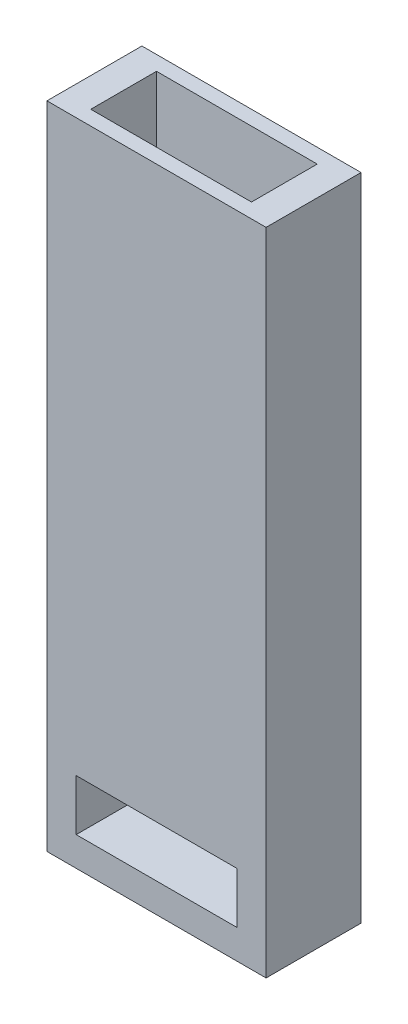
from build123d import *

# Parameters (mm, degrees)
SKETCH1_W           = 30
SKETCH1_H           = 13
BOSS_EXTRUDE1_DEPTH = 85
SKETCH2_W           = 22
SKETCH2_H           = 9
CUT_EXTRUDE2_DEPTH  = 85
SKETCH5_W           = 30
SKETCH5_H           = 13
BOSS_EXTRUDE3_DEPTH = 4
SKETCH12_W          = 22
SKETCH12_H          = 7
CUT_EXTRUDE4_DEPTH  = 13


with BuildPart() as part:
    # Sketch1 → Boss-Extrude1 (new body)
    with BuildSketch(Plane(origin=(0, 0, 0), x_dir=(1, 0, 0), z_dir=(0, 1, 0))):
        with Locations((15, -6.5)):
            Rectangle(SKETCH1_W, SKETCH1_H)
    extrude(amount=BOSS_EXTRUDE1_DEPTH)

    # Sketch2 → Cut-Extrude2 (cut)
    with BuildSketch(Plane(origin=(0, 85, 0), x_dir=(1, 0, 0), z_dir=(0, 1, 0))):
        with Locations((15, -6.5)):
            Rectangle(SKETCH2_W, SKETCH2_H)
    extrude(amount=-CUT_EXTRUDE2_DEPTH, mode=Mode.SUBTRACT)

    # Sketch5 → Boss-Extrude3 (add)
    with BuildSketch(Plane(origin=(0, 0, 0), x_dir=(1, 0, 0), z_dir=(0, 1, 0))):
        with Locations((15, -6.5)):
            Rectangle(SKETCH5_W, SKETCH5_H)
    extrude(amount=-BOSS_EXTRUDE3_DEPTH)

    # Sketch12 → Cut-Extrude4 (cut)
    with BuildSketch(Plane.XY.offset(13)):
        with Locations((15, 3.5)):
            Rectangle(SKETCH12_W, SKETCH12_H)
    extrude(amount=-CUT_EXTRUDE4_DEPTH, mode=Mode.SUBTRACT)


solid = part.part
